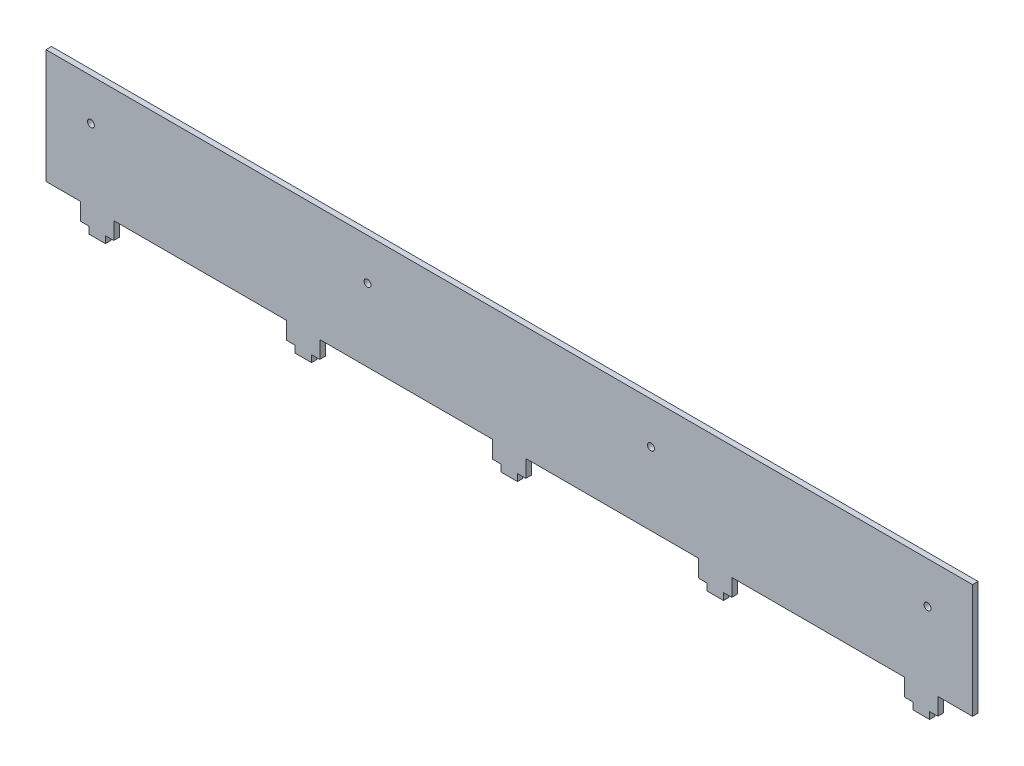
from build123d import *

# Parameters (mm, degrees)
SKETCH_1_W          = 670
SKETCH_1_H          = 95
EXTRUDE_1_DEPTH     = 2
SKETCH_2_W          = 125
SKETCH_2_H          = 12.454397838
CUT_EXTRUDE_1_DEPTH = 339.374422792
SKETCH_5_R          = 2.5
CUT_EXTRUDE_4_DEPTH = 339.374422792
SKETCH_6_W          = 12
SKETCH_6_H          = 4
EXTRUDE_2_DEPTH     = 5


with BuildPart() as part:
    # Эскиз1 → Бобышка-Вытянуть1 (new, symmetric)
    with BuildSketch(Plane.XY):
        Rectangle(SKETCH_1_W, SKETCH_1_H)
    extrude(amount=EXTRUDE_1_DEPTH, both=True)

    # Эскиз2 → Вырез-Вытянуть1 (cut, through all)
    with BuildSketch(Plane.XY.offset(2)):
        with Locations((-372.5, -41.272801081)):
            Rectangle(SKETCH_2_W, SKETCH_2_H)
        with Locations((-223.5, -41.272801081)):
            Rectangle(SKETCH_2_W, SKETCH_2_H)
        with Locations((-74.5, -41.272801081)):
            Rectangle(SKETCH_2_W, SKETCH_2_H)
        with Locations((74.5, -41.272801081)):
            Rectangle(SKETCH_2_W, SKETCH_2_H)
        with Locations((223.5, -41.272801081)):
            Rectangle(SKETCH_2_W, SKETCH_2_H)
        with Locations((372.5, -41.272801081)):
            Rectangle(SKETCH_2_W, SKETCH_2_H)
    extrude(amount=-CUT_EXTRUDE_1_DEPTH, mode=Mode.SUBTRACT)

    # Эскиз5 → Вырез-Вытянуть4 (cut, through all)
    with BuildSketch(Plane.XY.offset(2)):
        with Locations((-102.5, 17.5)):
            Circle(SKETCH_5_R)
        with Locations((102.5, 17.5)):
            Circle(SKETCH_5_R)
        with Locations((-302.5, 17.5)):
            Circle(SKETCH_5_R)
        with Locations((302.5, 17.5)):
            Circle(SKETCH_5_R)
    extrude(amount=-CUT_EXTRUDE_4_DEPTH, mode=Mode.SUBTRACT)

    # Эскиз6 → Бобышка-Вытянуть2 (add)
    with BuildSketch(Plane.XZ.offset(47.5)):
        with Locations((298, 0)):
            Rectangle(SKETCH_6_W, SKETCH_6_H)
        with Locations((149, 0)):
            Rectangle(SKETCH_6_W, SKETCH_6_H)
        Rectangle(SKETCH_6_W, SKETCH_6_H)
        with Locations((-149, 0)):
            Rectangle(SKETCH_6_W, SKETCH_6_H)
        with Locations((-298, 0)):
            Rectangle(SKETCH_6_W, SKETCH_6_H)
    extrude(amount=EXTRUDE_2_DEPTH)


solid = part.part
